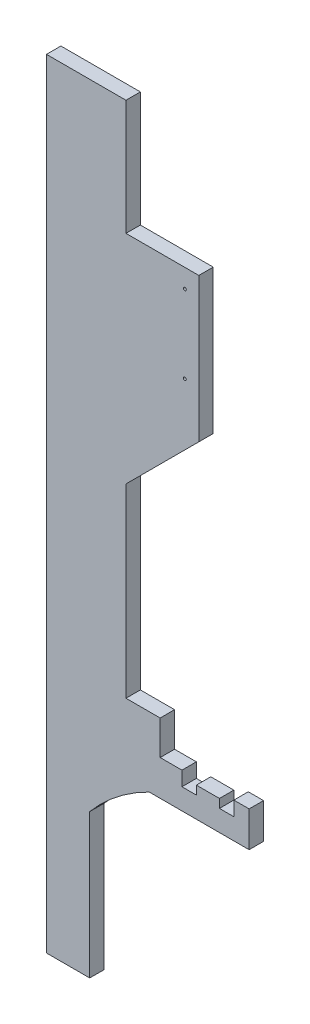
from build123d import *

# Parameters (mm, degrees)
BOSS_EXTRU_1_DEPTH      = 5
ESQUISSE3_R             = 0.5
ENL_V_MAT_EXTRU_1_DEPTH = 5


with BuildPart() as part:
    # Esquisse1 → Boss.-Extru.1 (new body)
    with BuildSketch(Plane.XY):
        with BuildLine():
            Line((70.297192809, 66.186397284), (70.297192809, 78.451204868))
            Line((70.297192809, 78.451204868), (39.439293445, 78.451204868))
            Line((39.439293445, 78.451204868), (39.439293445, 90.333987182))
            Line((39.439293445, 90.333987182), (27.572537656, 90.333987182))
            Line((27.572537656, 90.333987182), (27.572537656, 154.717501023))
            Line((27.572537656, 154.717501023), (52.855036633, 180))
            Line((52.855036633, 180), (52.855036633, 230))
            Line((52.855036633, 230), (27.572537656, 230))
            Line((27.572537656, 230), (27.572537656, 270))
            Line((27.572537656, 270), (0, 270))
            Line((0, 270), (0, 0))
            Line((0, 0), (15, 0))
            Line((15, 0), (15, 50))
            ThreePointArc((15, 50), (24.488558001, 59.174106779), (35.670004688, 66.186397284))
            Line((35.670004688, 66.186397284), (70.297192809, 66.186397284))
        make_face()
    extrude(amount=BOSS_EXTRU_1_DEPTH)

    # Esquisse3 → Enlèv. mat.-Extru.1 (cut)
    with BuildSketch(Plane.XY.offset(5)):
        with Locations((48, 223.5)):
            Circle(ESQUISSE3_R)
        with Locations((48, 196.5)):
            Circle(ESQUISSE3_R)
        Polygon((52, 76.451204868), (60, 76.451204868), (60, 73.451204868), (65, 73.451204868), (65, 78.451204868), (47, 78.451204868), (47, 73.451204868), (52, 73.451204868), align=None)
    extrude(amount=-ENL_V_MAT_EXTRU_1_DEPTH, mode=Mode.SUBTRACT)


solid = part.part
